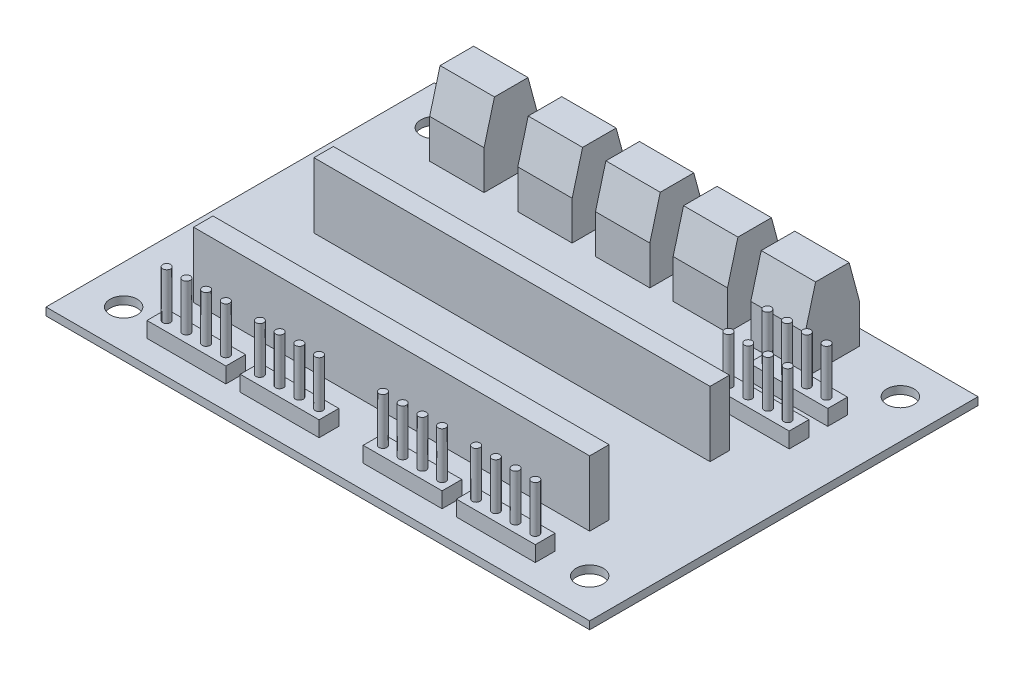
from build123d import *
from OCP.BRepFilletAPI import BRepFilletAPI_MakeChamfer

# Parameters (mm, degrees)
SKETCH_2_W      = 70
SKETCH_2_H      = 50
SKETCH_2_R      = 1.75
EXTRUDE_1_DEPTH = 1
SKETCH_3_W      = 51
SKETCH_3_H      = 2.5
EXTRUDE_2_DEPTH = 8.4
SKETCH_4_W      = 10.16
SKETCH_4_H      = 2.54
EXTRUDE_3_DEPTH = 2
SKETCH_5_R      = 0.5
EXTRUDE_4_DEPTH = 6
SKETCH_6_W      = 7
SKETCH_6_H      = 7
EXTRUDE_5_DEPTH = 10
CHAMFER_1_SIZE  = 5
CHAMFER_1_SIZE2 = 1.339745962


with BuildPart() as part:
    # Эскиз2 → Бобышка-Вытянуть1 (new body)
    with BuildSketch(Plane(origin=(0, 0, 0), x_dir=(1, 0, 0), z_dir=(0, 1, 0))):
        with Locations((35, 25)):
            Rectangle(SKETCH_2_W, SKETCH_2_H)
        with Locations((5, 45)):
            Circle(SKETCH_2_R, mode=Mode.SUBTRACT)
        with Locations((65, 45)):
            Circle(SKETCH_2_R, mode=Mode.SUBTRACT)
        with Locations((65, 5)):
            Circle(SKETCH_2_R, mode=Mode.SUBTRACT)
        with Locations((5, 5)):
            Circle(SKETCH_2_R, mode=Mode.SUBTRACT)
    extrude(amount=EXTRUDE_1_DEPTH)

    # Эскиз3 → Бобышка-Вытянуть2 (add)
    with BuildSketch(Plane(origin=(0, 1, 0), x_dir=(1, 0, 0), z_dir=(0, 1, 0))):
        with Locations((34.5, 11.25)):
            Rectangle(SKETCH_3_W, SKETCH_3_H)
        with Locations((34.5, 26.75)):
            Rectangle(SKETCH_3_W, SKETCH_3_H)
    extrude(amount=EXTRUDE_2_DEPTH)

    # Эскиз4 → Бобышка-Вытянуть3 (add)
    with BuildSketch(Plane(origin=(0, 1, 0), x_dir=(1, 0, 0), z_dir=(0, 1, 0))):
        with Locations((54.92, 4.27)):
            Rectangle(SKETCH_4_W, SKETCH_4_H)
        with Locations((42.92, 4.27)):
            Rectangle(SKETCH_4_W, SKETCH_4_H)
        with Locations((15.08, 4.27)):
            Rectangle(SKETCH_4_W, SKETCH_4_H)
        with Locations((27.08, 4.27)):
            Rectangle(SKETCH_4_W, SKETCH_4_H)
        with Locations((58.562253528, 38.283187026)):
            Rectangle(SKETCH_4_W, SKETCH_4_H)
        with Locations((58.594566993, 33.283187026)):
            Rectangle(SKETCH_4_W, SKETCH_4_H)
    extrude(amount=EXTRUDE_3_DEPTH)

    # Эскиз5 → Бобышка-Вытянуть4 (add)
    with BuildSketch(Plane(origin=(0, 3, 0), x_dir=(1, 0, 0), z_dir=(0, 1, 0))):
        with Locations((58.73, 4.27)):
            Circle(SKETCH_5_R)
        with Locations((56.19, 4.27)):
            Circle(SKETCH_5_R)
        with Locations((53.65, 4.27)):
            Circle(SKETCH_5_R)
        with Locations((51.11, 4.27)):
            Circle(SKETCH_5_R)
        with Locations((46.73, 4.27)):
            Circle(SKETCH_5_R)
        with Locations((44.19, 4.27)):
            Circle(SKETCH_5_R)
        with Locations((41.65, 4.27)):
            Circle(SKETCH_5_R)
        with Locations((39.11, 4.27)):
            Circle(SKETCH_5_R)
        with Locations((25.81, 4.27)):
            Circle(SKETCH_5_R)
        with Locations((11.27, 4.27)):
            Circle(SKETCH_5_R)
        with Locations((13.81, 4.27)):
            Circle(SKETCH_5_R)
        with Locations((16.35, 4.27)):
            Circle(SKETCH_5_R)
        with Locations((18.89, 4.27)):
            Circle(SKETCH_5_R)
        with Locations((23.27, 4.27)):
            Circle(SKETCH_5_R)
        with Locations((28.35, 4.27)):
            Circle(SKETCH_5_R)
        with Locations((30.89, 4.27)):
            Circle(SKETCH_5_R)
        with Locations((54.67096141, 33.208395661)):
            Circle(SKETCH_5_R)
        with Locations((54.67096141, 38.208395661)):
            Circle(SKETCH_5_R)
        with Locations((57.21096141, 33.208395661)):
            Circle(SKETCH_5_R)
        with Locations((59.75096141, 33.208395661)):
            Circle(SKETCH_5_R)
        with Locations((62.29096141, 33.208395661)):
            Circle(SKETCH_5_R)
        with Locations((57.21096141, 38.208395661)):
            Circle(SKETCH_5_R)
        with Locations((59.75096141, 38.208395661)):
            Circle(SKETCH_5_R)
        with Locations((62.29096141, 38.208395661)):
            Circle(SKETCH_5_R)
    extrude(amount=EXTRUDE_4_DEPTH)

    # Эскиз6 → Бобышка-Вытянуть5 (add)
    with BuildSketch(Plane(origin=(0, 1, 0), x_dir=(1, 0, 0), z_dir=(0, 1, 0))):
        with Locations((23.247184381, 44.500218353)):
            Rectangle(SKETCH_6_W, SKETCH_6_H)
        with Locations((11.946306787, 44.453594358)):
            Rectangle(SKETCH_6_W, SKETCH_6_H)
        with Locations((33.247184381, 44.500218353)):
            Rectangle(SKETCH_6_W, SKETCH_6_H)
        with Locations((43.247184381, 44.500218353)):
            Rectangle(SKETCH_6_W, SKETCH_6_H)
        with Locations((53.247184381, 44.500218353)):
            Rectangle(SKETCH_6_W, SKETCH_6_H)
    extrude(amount=EXTRUDE_5_DEPTH)

    # Фаска1: one chamfer whose edges measure the first distance from different faces: ONE call of the kernel's chamfer builder (chamfer() names one face for all edges)
    chamfer_1_edges_1 = [part.edges().sort_by_distance(p)[0] for p in [
        (53.247184381, 11, -48.000218353),
    ]]
    chamfer_1_side_1 = [part.faces().sort_by_distance(p)[0] for p in [
        (53.247184381, 6, -48.000218353),
    ]]
    chamfer_1_edges_2 = [part.edges().sort_by_distance(p)[0] for p in [
        (53.247184381, 11, -41.000218353),
    ]]
    chamfer_1_side_2 = [part.faces().sort_by_distance(p)[0] for p in [
        (53.247184381, 6, -41.000218353),
    ]]
    chamfer_1_edges_3 = [part.edges().sort_by_distance(p)[0] for p in [
        (43.247184381, 11, -48.000218353),
    ]]
    chamfer_1_side_3 = [part.faces().sort_by_distance(p)[0] for p in [
        (43.247184381, 6, -48.000218353),
    ]]
    chamfer_1_edges_4 = [part.edges().sort_by_distance(p)[0] for p in [
        (43.247184381, 11, -41.000218353),
    ]]
    chamfer_1_side_4 = [part.faces().sort_by_distance(p)[0] for p in [
        (43.247184381, 6, -41.000218353),
    ]]
    chamfer_1_edges_5 = [part.edges().sort_by_distance(p)[0] for p in [
        (33.247184381, 11, -41.000218353),
    ]]
    chamfer_1_side_5 = [part.faces().sort_by_distance(p)[0] for p in [
        (33.247184381, 6, -41.000218353),
    ]]
    chamfer_1_edges_6 = [part.edges().sort_by_distance(p)[0] for p in [
        (33.247184381, 11, -48.000218353),
    ]]
    chamfer_1_side_6 = [part.faces().sort_by_distance(p)[0] for p in [
        (33.247184381, 6, -48.000218353),
    ]]
    chamfer_1_edges_7 = [part.edges().sort_by_distance(p)[0] for p in [
        (23.247184381, 11, -48.000218353),
    ]]
    chamfer_1_side_7 = [part.faces().sort_by_distance(p)[0] for p in [
        (23.247184381, 6, -48.000218353),
    ]]
    chamfer_1_edges_8 = [part.edges().sort_by_distance(p)[0] for p in [
        (23.247184381, 11, -41.000218353),
    ]]
    chamfer_1_side_8 = [part.faces().sort_by_distance(p)[0] for p in [
        (23.247184381, 6, -41.000218353),
    ]]
    chamfer_1_edges_9 = [part.edges().sort_by_distance(p)[0] for p in [
        (11.946306787, 11, -47.953594358),
    ]]
    chamfer_1_side_9 = [part.faces().sort_by_distance(p)[0] for p in [
        (11.946306787, 6, -47.953594358),
    ]]
    chamfer_1_edges_10 = [part.edges().sort_by_distance(p)[0] for p in [
        (11.946306787, 11, -40.953594358),
    ]]
    chamfer_1_side_10 = [part.faces().sort_by_distance(p)[0] for p in [
        (11.946306787, 6, -40.953594358),
    ]]
    chamfer_1 = BRepFilletAPI_MakeChamfer(part.part.solid().wrapped)
    for e in chamfer_1_edges_1:
        chamfer_1.Add(CHAMFER_1_SIZE, CHAMFER_1_SIZE2, e.wrapped, chamfer_1_side_1[0].wrapped)  # the first distance lies on this face
    for e in chamfer_1_edges_2:
        chamfer_1.Add(CHAMFER_1_SIZE, CHAMFER_1_SIZE2, e.wrapped, chamfer_1_side_2[0].wrapped)  # the first distance lies on this face
    for e in chamfer_1_edges_3:
        chamfer_1.Add(CHAMFER_1_SIZE, CHAMFER_1_SIZE2, e.wrapped, chamfer_1_side_3[0].wrapped)  # the first distance lies on this face
    for e in chamfer_1_edges_4:
        chamfer_1.Add(CHAMFER_1_SIZE, CHAMFER_1_SIZE2, e.wrapped, chamfer_1_side_4[0].wrapped)  # the first distance lies on this face
    for e in chamfer_1_edges_5:
        chamfer_1.Add(CHAMFER_1_SIZE, CHAMFER_1_SIZE2, e.wrapped, chamfer_1_side_5[0].wrapped)  # the first distance lies on this face
    for e in chamfer_1_edges_6:
        chamfer_1.Add(CHAMFER_1_SIZE, CHAMFER_1_SIZE2, e.wrapped, chamfer_1_side_6[0].wrapped)  # the first distance lies on this face
    for e in chamfer_1_edges_7:
        chamfer_1.Add(CHAMFER_1_SIZE, CHAMFER_1_SIZE2, e.wrapped, chamfer_1_side_7[0].wrapped)  # the first distance lies on this face
    for e in chamfer_1_edges_8:
        chamfer_1.Add(CHAMFER_1_SIZE, CHAMFER_1_SIZE2, e.wrapped, chamfer_1_side_8[0].wrapped)  # the first distance lies on this face
    for e in chamfer_1_edges_9:
        chamfer_1.Add(CHAMFER_1_SIZE, CHAMFER_1_SIZE2, e.wrapped, chamfer_1_side_9[0].wrapped)  # the first distance lies on this face
    for e in chamfer_1_edges_10:
        chamfer_1.Add(CHAMFER_1_SIZE, CHAMFER_1_SIZE2, e.wrapped, chamfer_1_side_10[0].wrapped)  # the first distance lies on this face
    add(Compound.cast(chamfer_1.Shape()), mode=Mode.REPLACE)


solid = part.part
